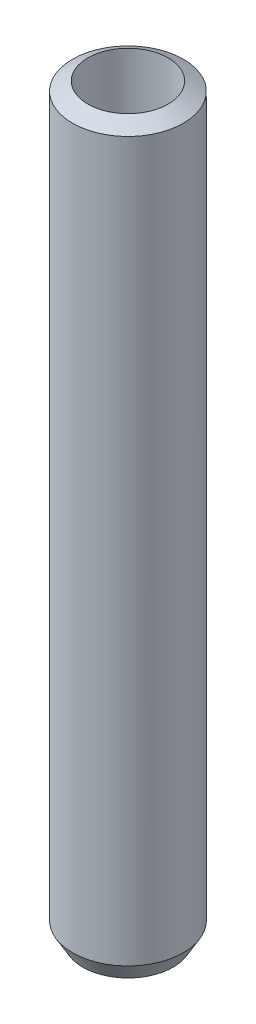
from build123d import *

# Parameters (mm, degrees)
SKETCH1_R           = 25
BOSS_EXTRUDE1_DEPTH = 336.383451
SKETCH2_R           = 18.081362876
CUT_EXTRUDE1_DEPTH  = 339.236346519
CHAMFER1_SIZE       = 4.592063
CHAMFER1_SIZE_2     = 7.953686


with BuildPart() as part:
    # Sketch1 → Boss-Extrude1 (new body)
    with BuildSketch(Plane(origin=(0, 0, 0), x_dir=(1, 0, 0), z_dir=(0, 1, 0))):
        with Locations(Location((0, 0, 0), (0, 0, 270))):
            Circle(SKETCH1_R)
    extrude(amount=BOSS_EXTRUDE1_DEPTH)

    # Sketch2 → Cut-Extrude1 (cut, through all)
    with BuildSketch(Plane(origin=(0, 0, 0), x_dir=(1, 0, 0), z_dir=(0, 1, 0))):
        with Locations(Location((0, 0, 0), (0, 0, 270))):
            Circle(SKETCH2_R)
    extrude(amount=CUT_EXTRUDE1_DEPTH, mode=Mode.SUBTRACT)

    # Chamfer1
    # the kernel refuses this chamfer: 7.953686, 4.592063 mm, written as the material it takes off along each edge
    with BuildSketch(Plane(origin=(0, 336.383451, 0), x_dir=(0, 0, 1), z_dir=(-1, 0, 0))) as chamfer1_piece_1:
        Polygon((25, -CHAMFER1_SIZE), (25 - CHAMFER1_SIZE_2, 0), (25, 0), align=None)
    revolve(axis=Axis((0, 336.383451, 0), (0, 1, 0)), mode=Mode.SUBTRACT)
    with BuildSketch(Plane(origin=(0, 0, 0), x_dir=(0, 0, 1), z_dir=(-1, 0, 0))) as chamfer1_piece_2:
        Polygon((25, CHAMFER1_SIZE_2), (25 - CHAMFER1_SIZE, 0), (25, 0), align=None)
    revolve(axis=Axis((0, 0, 0), (0, 1, 0)), mode=Mode.SUBTRACT)


solid = part.part
